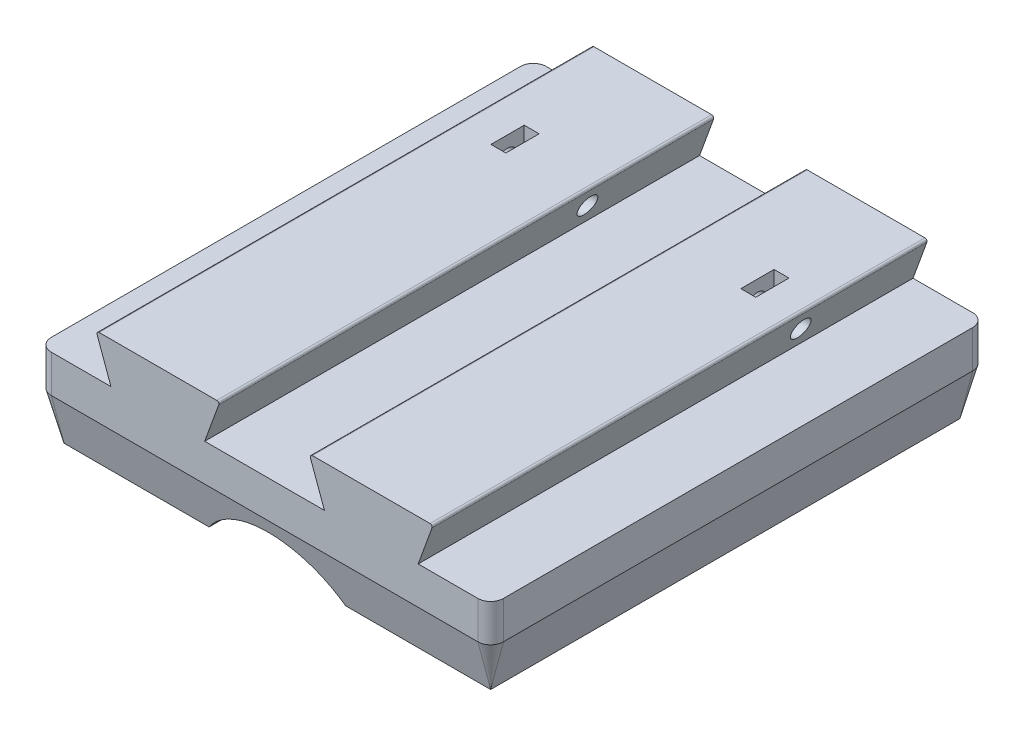
from build123d import *

# Parameters (mm, degrees)
BOSS_EXTRUDE1_DEPTH = 116
FILLET1_R           = 3
CHAMFER2_SIZE       = 3
CHAMFER2_SIZE_2     = 11.196152423
FILLET2_R           = 0.5
SKETCH3_W           = 3.5
SKETCH3_H           = 7.8
CUT_EXTRUDE1_DEPTH  = 9
SKETCH4_R           = 2.3
CUT_EXTRUDE2_DEPTH  = 161.962973694
CUT_EXTRUDE3_START  = -20
CUT_EXTRUDE3_DEPTH  = 22
CUT_EXTRUDE4_START  = -74
CUT_EXTRUDE4_DEPTH  = 22


with BuildPart() as part:
    # Sketch2 → Boss-Extrude1 (new body)
    with BuildSketch(Plane.XY):
        with BuildLine():
            Line((-39.5, -5.286657915), (-10.5, -5.286657915))
            Line((-10.5, -5.286657915), (-14.035367394, -15))
            Line((-14.035367394, -15), (14.035367394, -15))
            Line((14.035367394, -15), (10.5, -5.286657915))
            Line((10.5, -5.286657915), (39.5, -5.286657915))
            Line((39.5, -5.286657915), (36.005885751, -14.886657915))
            Line((36.005885751, -14.886657915), (53, -14.886657915))
            Line((53, -14.886657915), (53, -34.886657915))
            Line((53, -34.886657915), (16, -34.886657915))
            ThreePointArc((16, -34.886657915), (0, -26.886657915), (-16, -34.886657915))
            Line((-16, -34.886657915), (-53, -34.886657915))
            Line((-53, -34.886657915), (-53, -14.886657915))
            Line((-53, -14.886657915), (-36.005885751, -14.886657915))
            Line((-36.005885751, -14.886657915), (-39.5, -5.286657915))
        make_face()
    extrude(amount=BOSS_EXTRUDE1_DEPTH)

    # Fillet1
    fillet1_edges = [part.edges().sort_by_distance(p)[0] for p in [
        (-53, -24.886657915, 0),
        (53, -24.886657915, 0),
        (-53, -24.886657915, 116),
        (53, -24.886657915, 116),
    ]]
    fillet(fillet1_edges, radius=FILLET1_R)

    # Chamfer2
    # the kernel refuses this chamfer: 11.196152423, 3 mm, written as the material it takes off along each edge
    with BuildSketch(Plane(origin=(50, -34.886657915, 3), x_dir=(1, 0, 0), z_dir=(0, 0, 1))) as chamfer2_piece_1:
        Polygon((3 - CHAMFER2_SIZE, 0), (3, CHAMFER2_SIZE_2), (3, 0), align=None)
    revolve(axis=Axis((50, -34.886657915, 3), (0, 1, 0)), revolution_arc=90, mode=Mode.SUBTRACT)
    with BuildSketch(Plane(origin=(50, -34.886657915, 116), x_dir=(0, 1, 0), z_dir=(-1, 0, 0))) as chamfer2_piece_2:
        Polygon((CHAMFER2_SIZE_2, 0), (0, CHAMFER2_SIZE), (0, 0), align=None)
    extrude(amount=63.073290499, mode=Mode.SUBTRACT)
    with BuildSketch(Plane(origin=(13.073290499, -34.886657915, 0), x_dir=(0, 0, 1), z_dir=(-1, 0, 0))) as chamfer2_piece_3:
        Polygon((CHAMFER2_SIZE, 0), (0, CHAMFER2_SIZE_2), (0, 0), align=None)
    extrude(amount=63.073290499, mode=Mode.SUBTRACT)
    with BuildSketch(Plane(origin=(-50, -34.886657915, 113), x_dir=(-1, 0, 0), z_dir=(0, 0, -1))) as chamfer2_piece_4:
        Polygon((3 - CHAMFER2_SIZE, 0), (3, CHAMFER2_SIZE_2), (3, 0), align=None)
    revolve(axis=Axis((-50, -34.886657915, 113), (0, 1, 0)), revolution_arc=90, mode=Mode.SUBTRACT)
    with BuildSketch(Plane(origin=(-53, -34.886657915, 3), x_dir=(1, 0, 0), z_dir=(0, 0, 1))) as chamfer2_piece_5:
        Polygon((CHAMFER2_SIZE, 0), (0, CHAMFER2_SIZE_2), (0, 0), align=None)
    extrude(amount=110, mode=Mode.SUBTRACT)
    with BuildSketch(Plane(origin=(-50, -34.886657915, 3), x_dir=(-1, 0, 0), z_dir=(0, 0, 1))) as chamfer2_piece_6:
        Polygon((3 - CHAMFER2_SIZE, 0), (3, -CHAMFER2_SIZE_2), (3, 0), align=None)
    revolve(axis=Axis((-50, -34.886657915, 3), (0, -1, 0)), revolution_arc=90, mode=Mode.SUBTRACT)
    with BuildSketch(Plane(origin=(13.073290499, -34.886657915, 116), x_dir=(0, 0, -1), z_dir=(-1, 0, 0))) as chamfer2_piece_7:
        Polygon((CHAMFER2_SIZE, 0), (0, -CHAMFER2_SIZE_2), (0, 0), align=None)
    extrude(amount=63.073290499, mode=Mode.SUBTRACT)
    with BuildSketch(Plane(origin=(50, -34.886657915, 113), x_dir=(1, 0, 0), z_dir=(0, 0, -1))) as chamfer2_piece_8:
        Polygon((3 - CHAMFER2_SIZE, 0), (3, -CHAMFER2_SIZE_2), (3, 0), align=None)
    revolve(axis=Axis((50, -34.886657915, 113), (0, -1, 0)), revolution_arc=90, mode=Mode.SUBTRACT)
    with BuildSketch(Plane(origin=(53, -34.886657915, 3), x_dir=(-1, 0, 0), z_dir=(0, 0, 1))) as chamfer2_piece_9:
        Polygon((CHAMFER2_SIZE, 0), (0, -CHAMFER2_SIZE_2), (0, 0), align=None)
    extrude(amount=110, mode=Mode.SUBTRACT)
    with BuildSketch(Plane(origin=(50, -34.886657915, 0), x_dir=(0, 1, 0), z_dir=(-1, 0, 0))) as chamfer2_piece_10:
        Polygon((CHAMFER2_SIZE_2, 0), (0, -CHAMFER2_SIZE), (0, 0), align=None)
    extrude(amount=63.073290499, mode=Mode.SUBTRACT)

    # Fillet2
    fillet2_edges = [part.edges().sort_by_distance(p)[0] for p in [
        (39.5, -5.286657915, 58),
        (10.5, -5.286657915, 58),
        (-10.5, -5.286657915, 58),
        (-39.5, -5.286657915, 58),
    ]]
    fillet(fillet2_edges, radius=FILLET2_R)

    # Sketch3 → Cut-Extrude1 (cut)
    with BuildSketch(Plane(origin=(0, -5.286657915, 0), x_dir=(1, 0, 0), z_dir=(0, 1, 0))):
        with Locations((-29.285925997, -28)):
            Rectangle(SKETCH3_W, SKETCH3_H)
        with Locations((29.285925997, -28)):
            Rectangle(SKETCH3_W, SKETCH3_H)
    extrude(amount=-CUT_EXTRUDE1_DEPTH, mode=Mode.SUBTRACT)

    # Sketch4 → Cut-Extrude2 (cut, through all)
    with BuildSketch(Plane.ZY.offset(53)):
        with Locations(Location((28, -10.286657915, 0), (0, 0, 270))):
            Circle(SKETCH4_R)
    extrude(amount=-CUT_EXTRUDE2_DEPTH, mode=Mode.SUBTRACT)

    # Sketch5 → Cut-Extrude3 (cut)
    with BuildSketch(Plane(origin=(0, 0, 0), x_dir=(-1, 0, 0), z_dir=(0, 0, -1)).offset(CUT_EXTRUDE3_START)):
        with BuildLine():
            ThreePointArc((9.324082409, -23.690505492), (20.713547019, -32.888480537), (25, -46.886657915))
            ThreePointArc((25, -46.886657915), (-13.998177377, -67.600204934), (-9.324082409, -23.690505492))
            Line((-9.324082409, -23.690505492), (-19.024681673, -23.690505492))
            ThreePointArc((-19.024681673, -23.690505492), (-12.830813493, -74.004368458), (30, -46.886657915))
            ThreePointArc((30, -46.886657915), (27.117710543, -34.055844421), (19.024681673, -23.690505492))
            Line((19.024681673, -23.690505492), (9.324082409, -23.690505492))
        make_face()
        with BuildLine():
            ThreePointArc((-9.324082409, -23.690505492), (0, -21.886657915), (9.324082409, -23.690505492))
            Line((9.324082409, -23.690505492), (19.024681673, -23.690505492))
            ThreePointArc((19.024681673, -23.690505492), (0, -16.886657915), (-19.024681673, -23.690505492))
            Line((-19.024681673, -23.690505492), (-9.324082409, -23.690505492))
        make_face()
    extrude(amount=-CUT_EXTRUDE3_DEPTH, mode=Mode.SUBTRACT)

    # Sketch5<3> → Cut-Extrude4 (cut)
    with BuildSketch(Plane(origin=(0, 0, 0), x_dir=(-1, 0, 0), z_dir=(0, 0, -1)).offset(CUT_EXTRUDE4_START)):
        with BuildLine():
            ThreePointArc((9.324082409, -23.690505492), (20.713547019, -32.888480537), (25, -46.886657915))
            ThreePointArc((25, -46.886657915), (-13.998177377, -67.600204934), (-9.324082409, -23.690505492))
            Line((-9.324082409, -23.690505492), (-19.024681673, -23.690505492))
            ThreePointArc((-19.024681673, -23.690505492), (-12.830813493, -74.004368458), (30, -46.886657915))
            ThreePointArc((30, -46.886657915), (27.117710543, -34.055844421), (19.024681673, -23.690505492))
            Line((19.024681673, -23.690505492), (9.324082409, -23.690505492))
        make_face()
        with BuildLine():
            ThreePointArc((-9.324082409, -23.690505492), (0, -21.886657915), (9.324082409, -23.690505492))
            Line((9.324082409, -23.690505492), (19.024681673, -23.690505492))
            ThreePointArc((19.024681673, -23.690505492), (0, -16.886657915), (-19.024681673, -23.690505492))
            Line((-19.024681673, -23.690505492), (-9.324082409, -23.690505492))
        make_face()
    extrude(amount=-CUT_EXTRUDE4_DEPTH, mode=Mode.SUBTRACT)


solid = part.part
